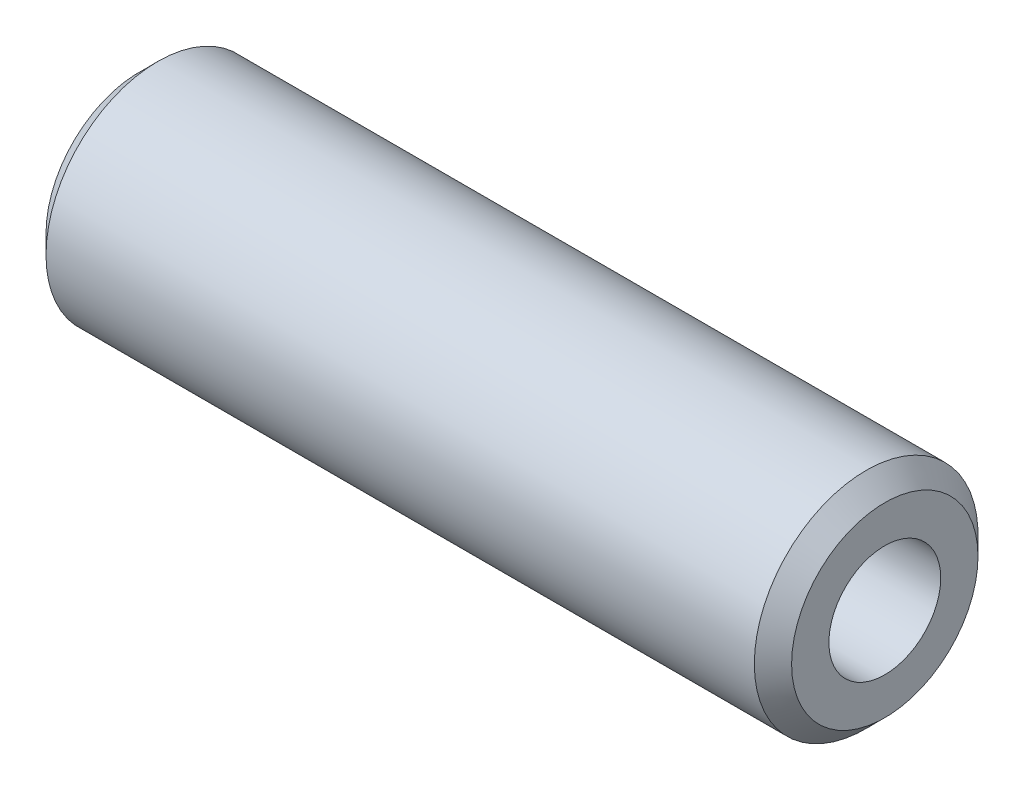
from build123d import *

# Parameters (mm, degrees)
SKETCH_1_W     = 20
SKETCH_1_H     = 3
CHAMFER_1_SIZE = 0.5


# Read off the part's stored shape, not the designer's step: M3x0.5 ねじ穴2
with BuildPart() as part:
    # ｽｹｯﾁ1 → 回転1 (revolve)
    with BuildSketch(Plane.XY, mode=Mode.PRIVATE) as revolve_1_sk:
        with Locations((0, 1.5)):
            Rectangle(SKETCH_1_W, SKETCH_1_H)
    revolve(revolve_1_sk.sketch.rotate(Axis((0, 0, 0), (1, 0, 0)), 90), axis=Axis((0, 0, 0), (1, 0, 0)))

    # M3x0.5 ねじ穴2 outline → M3x0.5 ねじ穴2 (revolve, cut)
    with BuildSketch(Plane.YX):
        Polygon((0, 10), (0, 0.748924226), (1.25, 1.5), (1.25, 4), (1.5, 4), (1.5, 10), align=None)
        Polygon((1.25, -1.5), (0, -0.748924226), (0, -10), (1.5, -10), (1.5, -4), (1.25, -4), align=None)
    revolve(axis=Axis((0, 0, 0), (1, 0, 0)), mode=Mode.SUBTRACT)

    # 面取り1
    chamfer_1_edges = [part.edges().sort_by_distance(p)[0] for p in [
        (-10, 0, -3),
        (10, 0, -3),
    ]]
    chamfer(chamfer_1_edges, length=CHAMFER_1_SIZE)


solid = part.part
